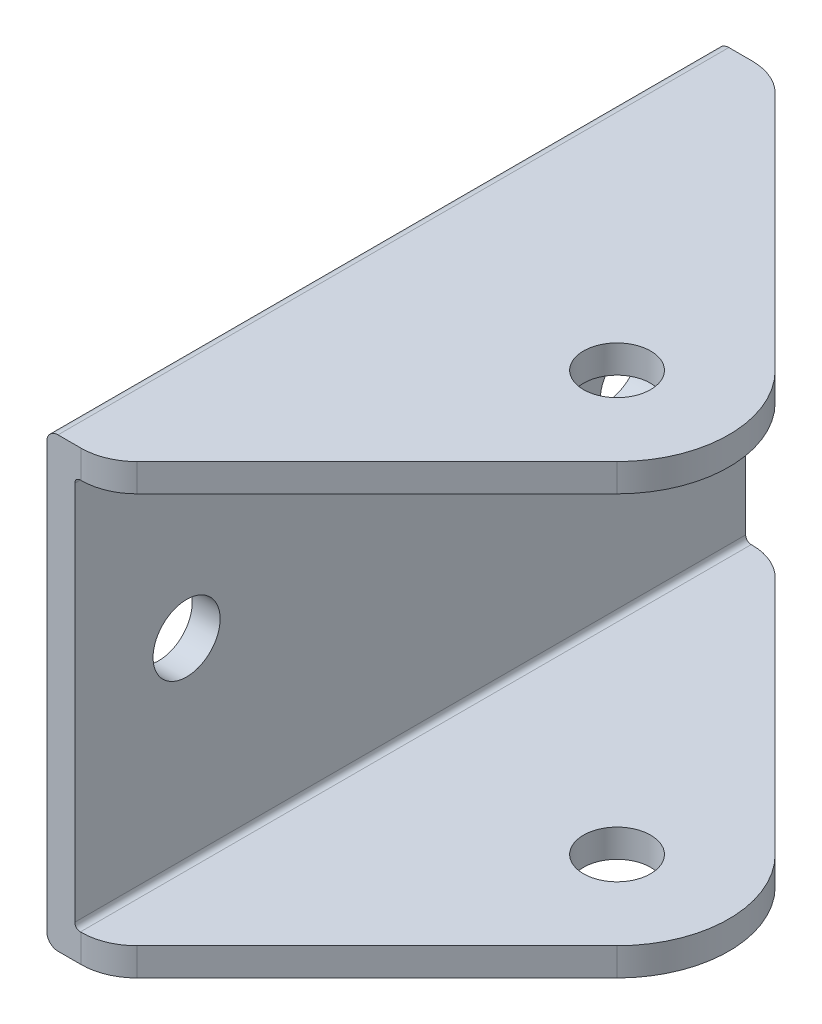
from build123d import *

# Parameters (mm, degrees)
SKETCH_1_W          = 40
SKETCH_1_H          = 40
SKETCH_1_W_2        = 35
SKETCH_1_H_2        = 35
EXTRUDE_1_DEPTH     = 100
FILLET_1_R          = 1
FILLET_2_R          = 0.5
SKETCH_2_OUTSIDE_W  = 64.978
SKETCH_2_OUTSIDE_H  = 124.978
SKETCH_2_OUTSIDE_R  = 3
CUT_EXTRUDE_1_DEPTH = 100
SKETCH_3_R          = 3
CUT_EXTRUDE_2_DEPTH = 100


with BuildPart() as part:
    # Эскиз1 → Бобышка-Вытянуть1 (new body)
    with BuildSketch(Plane.XY):
        with Locations((20, 20)):
            Rectangle(SKETCH_1_W, SKETCH_1_H)
        with Locations((20, 20)):
            Rectangle(SKETCH_1_W_2, SKETCH_1_H_2, mode=Mode.SUBTRACT)
    extrude(amount=EXTRUDE_1_DEPTH)

    # Скругление1
    fillet_1_edges = [part.edges().sort_by_distance(p)[0] for p in [
        (0, 0, 50),
        (0, 40, 50),
        (40, 0, 50),
        (40, 40, 50),
    ]]
    fillet(fillet_1_edges, radius=FILLET_1_R)

    # Скругление2
    fillet_2_edges = [part.edges().sort_by_distance(p)[0] for p in [
        (2.5, 2.5, 50),
        (2.5, 37.5, 50),
        (37.5, 37.5, 50),
        (37.5, 2.5, 50),
    ]]
    fillet(fillet_2_edges, radius=FILLET_2_R)

    # Эскиз2 outside → Вырез-Вытянуть1 (cut)
    # profile 1 of 2: a face of its own
    with BuildSketch(Plane(origin=(0, 40, 0), x_dir=(1, 0, 0), z_dir=(0, 1, 0))):
        with Locations((20, -50)):
            Rectangle(SKETCH_2_OUTSIDE_W, SKETCH_2_OUTSIDE_H)
        with BuildLine():
            Line((-2.32777455, -20), (3.071067812, -20))
            ThreePointArc((3.071067812, -20), (4.984484974, -20.380602337), (6.606601718, -21.464466094))
            Line((6.606601718, -21.464466094), (28.071067812, -42.928932188))
            ThreePointArc((28.071067812, -42.928932188), (31, -50), (28.071067812, -57.071067812))
            Line((28.071067812, -57.071067812), (6.606601718, -78.535533906))
            ThreePointArc((6.606601718, -78.535533906), (4.984484974, -79.619397663), (3.071067812, -80))
            Line((3.071067812, -80), (-2.32777455, -80))
            Line((-2.32777455, -80), (-2.32777455, -20))
        make_face(mode=Mode.SUBTRACT)
    # profile 2 of 2: a face of its own
    with BuildSketch(Plane(origin=(0, 40, 0), x_dir=(1, 0, 0), z_dir=(0, 1, 0))):
        with Locations((21, -50)):
            Circle(SKETCH_2_OUTSIDE_R)
    extrude(amount=-CUT_EXTRUDE_1_DEPTH, mode=Mode.SUBTRACT)

    # Эскиз3 → Вырез-Вытянуть2 (cut)
    with BuildSketch(Plane(origin=(2.5, 0, 0), x_dir=(0, 0, -1), z_dir=(1, 0, 0))):
        with Locations((-70, 20)):
            Circle(SKETCH_3_R)
        with Locations((-30, 20)):
            Circle(SKETCH_3_R)
    extrude(amount=-CUT_EXTRUDE_2_DEPTH, mode=Mode.SUBTRACT)


solid = part.part
